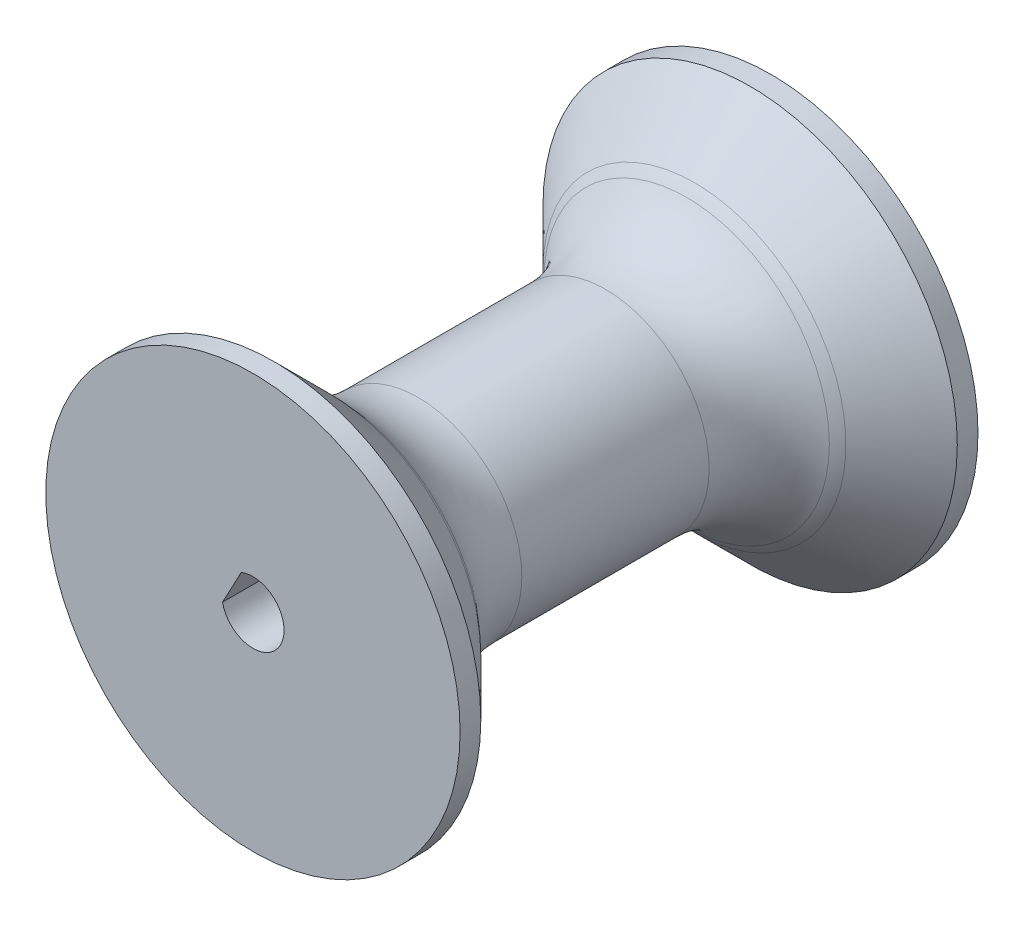
from build123d import *

# Parameters (mm, degrees)
SKETCH1_R           = 10
BOSS_EXTRUDE1_DEPTH = 5
SKETCH3_R           = 5
BOSS_EXTRUDE3_DEPTH = 15
SKETCH4_R           = 10
BOSS_EXTRUDE4_DEPTH = 5
CUT_EXTRUDE1_DEPTH  = 26
CHAMFER3_SIZE       = 4
FILLET6_R           = 5
FILLET7_R           = 5


with BuildPart() as part:
    # Sketch1 → Boss-Extrude1 (new body)
    with BuildSketch(Plane.XY):
        Circle(SKETCH1_R)
    extrude(amount=BOSS_EXTRUDE1_DEPTH)

    # Sketch3 → Boss-Extrude3 (add)
    with BuildSketch(Plane.XY.offset(5)):
        Circle(SKETCH3_R)
    extrude(amount=BOSS_EXTRUDE3_DEPTH)

    # Sketch4 → Boss-Extrude4 (add)
    with BuildSketch(Plane.XY.offset(20)):
        Circle(SKETCH4_R)
    extrude(amount=BOSS_EXTRUDE4_DEPTH)

    # Sketch5 → Cut-Extrude1 (cut)
    with BuildSketch(Plane(origin=(0, 0, 0), x_dir=(-1, 0, 0), z_dir=(0, 0, -1))):
        with BuildLine():
            Line((0.567187137, 1.388631971), (1.468830879, -0.304197058))
            ThreePointArc((1.468830879, -0.304197058), (-1.323918378, -0.705152558), (0.567187137, 1.388631971))
        make_face()
    extrude(amount=-CUT_EXTRUDE1_DEPTH, mode=Mode.SUBTRACT)

    # Chamfer3
    chamfer3_edges = [part.edges().sort_by_distance(p)[0] for p in [
        (-10, 0, 20),
        (-10, 0, 5),
    ]]
    chamfer(chamfer3_edges, length=CHAMFER3_SIZE)

    # Fillet6
    # the kernel refuses this fillet: 5 mm, written as the material it takes off along each edge
    with BuildSketch(Plane(origin=(0, 0, 20), x_dir=(1, 0, 0), z_dir=(0, -1, 0))) as fillet6_piece_1:
        with BuildLine():
            CenterArc((3.777070272, 4.848138084), FILLET6_R, 284.157365729, 30.842634271)
            Line((5, 0), (5.024458595, -0.096962762))
            ThreePointArc((5.024458595, -0.096962762), (5.5, -0.1), (6, -0.1))
            Line((6, -0.1), (6.070710678, -0.070710678))
            Line((6.070710678, -0.070710678), (7.383314856, 1.2418935))
            Line((7.383314856, 1.2418935), (7.312604178, 1.312604178))
        make_face()
    revolve(axis=Axis((0, 0, 20), (0, 0, 1)), mode=Mode.SUBTRACT)
    with BuildSketch(Plane(origin=(0, 0, 5), x_dir=(1, 0, 0), z_dir=(0, -1, 0))) as fillet6_piece_2:
        with BuildLine():
            CenterArc((3.777070272, -4.848138084), FILLET6_R, 45, 30.842634271)
            Line((7.312604178, -1.312604178), (7.383314856, -1.2418935))
            Line((7.383314856, -1.2418935), (6.070710678, 0.070710678))
            Line((6.070710678, 0.070710678), (6, 0.1))
            ThreePointArc((6, 0.1), (5.5, 0.1), (5.024458595, 0.096962762))
            Line((5.024458595, 0.096962762), (5, 0))
        make_face()
    revolve(axis=Axis((0, 0, 5), (0, 0, 1)), mode=Mode.SUBTRACT)

    # Fillet7
    fillet7_edges = [part.edges().sort_by_distance(p)[0] for p in [
        (-5, 0, 5),
        (-5, 0, 20),
    ]]
    fillet(fillet7_edges, radius=FILLET7_R)


solid = part.part
